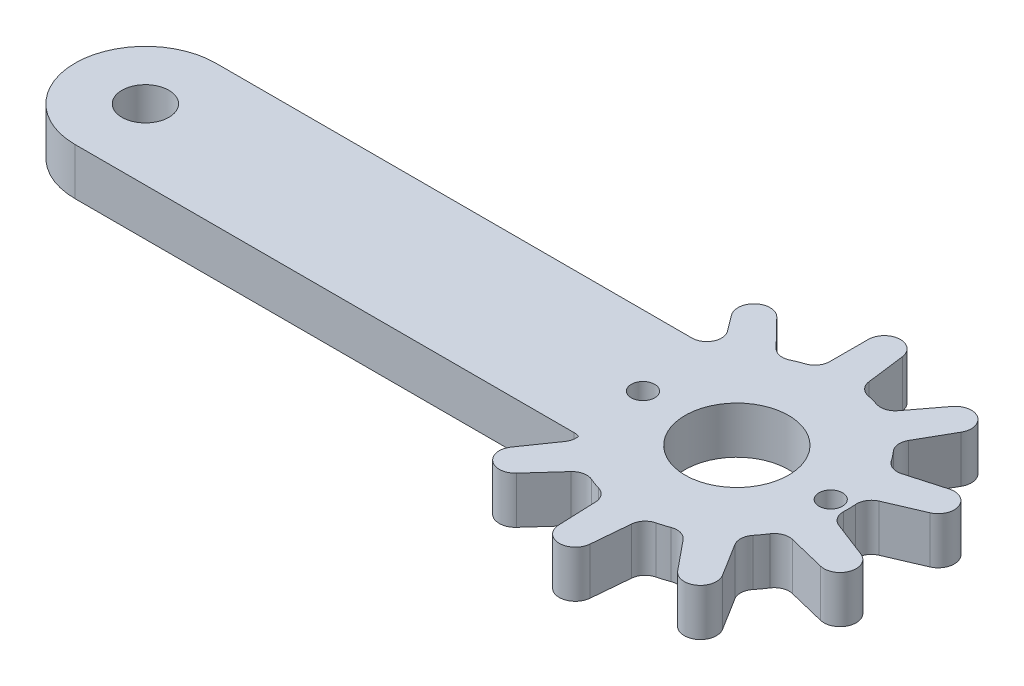
from build123d import *

# Parameters (mm, degrees)
CROQUIS1_R              = 1.5875
SALIENTE_EXTRUIR1_DEPTH = 3.175
SALIENTE_EXTRUIR2_START = -3.175
CROQUIS2_R              = 7.5
CROQUIS2_R_2            = 1.5875
SALIENTE_EXTRUIR2_DEPTH = 3.175
CROQUIS7_R              = 3.5
CROQUIS7_R_2            = 0.79375
CORTAR_EXTRUIR3_DEPTH   = 10
SALIENTE_EXTRUIR3_START = -3.175
SALIENTE_EXTRUIR3_DEPTH = 3.175
CORTAR_EXTRUIR4_START   = -10
CORTAR_EXTRUIR4_DEPTH   = 10
MATRIZC1_COUNT          = 8
MATRIZC1_ANGLE          = 259
REDONDEO1_R             = 1


with BuildPart() as part:
    # Croquis1 → Saliente-Extruir1 (new body)
    with BuildSketch(Plane(origin=(0, 0, 0), x_dir=(1, 0, 0), z_dir=(0, 1, 0))):
        with BuildLine():
            Line((-20, 0), (20, 0))
            ThreePointArc((20, 0), (24.7625, -4.7625), (20, -9.525))
            Line((20, -9.525), (-20, -9.525))
            ThreePointArc((-20, -9.525), (-24.7625, -4.7625), (-20, 0))
        make_face()
        with Locations(Location((-20, -4.7625, 0), (0, 0, 270))):
            Circle(CROQUIS1_R, mode=Mode.SUBTRACT)
        with Locations(Location((20, -4.7625, 0), (0, 0, 270))):
            Circle(CROQUIS1_R, mode=Mode.SUBTRACT)
    extrude(amount=SALIENTE_EXTRUIR1_DEPTH)

    # Croquis2 → Saliente-Extruir2 (add)
    with BuildSketch(Plane(origin=(0, 3.175, 0), x_dir=(1, 0, 0), z_dir=(0, 1, 0)).offset(SALIENTE_EXTRUIR2_START)):
        with Locations((20, -4.7625)):
            Circle(CROQUIS2_R)
        with Locations(Location((20, -4.7625, 0), (0, 0, 270))):
            Circle(CROQUIS2_R_2, mode=Mode.SUBTRACT)
    extrude(amount=SALIENTE_EXTRUIR2_DEPTH)

    # Croquis7 → Cortar-Extruir3 (cut)
    with BuildSketch(Plane(origin=(0, 3.175, 0), x_dir=(1, 0, 0), z_dir=(0, 1, 0))):
        with Locations(Location((20, -4.7625, 0), (0, 0, 270))):
            Circle(CROQUIS7_R)
        with Locations(Location((13.65, -4.7625, 0), (0, 0, 270))):
            Circle(CROQUIS7_R_2)
        with Locations(Location((26.35, -4.7625, 0), (0, 0, 270))):
            Circle(CROQUIS7_R_2)
    extrude(amount=-CORTAR_EXTRUIR3_DEPTH, mode=Mode.SUBTRACT)

    # Croquis8 → Saliente-Extruir3 (add)
    with BuildSketch(Plane(origin=(0, 3.175, 0), x_dir=(1, 0, 0), z_dir=(0, 1, 0)).offset(SALIENTE_EXTRUIR3_START)):
        with BuildLine():
            Line((11.607813982, 3.461471902), (14.206158981, 0))
            ThreePointArc((14.206158981, 0), (15.121179891, 0.933736858), (16.184441281, 1.694396442))
            Line((16.184441281, 1.694396442), (13.163387879, 4.793819098))
            ThreePointArc((13.163387879, 4.793819098), (12.356515163, 4.161604411), (11.607813982, 3.461471902))
        make_face()
    saliente_extruir3 = extrude(amount=SALIENTE_EXTRUIR3_DEPTH)

    # Croquis9 → Cortar-Extruir4 (cut)
    with BuildSketch(Plane(origin=(0, 3.175, 0), x_dir=(1, 0, 0), z_dir=(0, 1, 0)).offset(CORTAR_EXTRUIR4_START)):
        with BuildLine():
            ThreePointArc((12.35651523, 4.161604469), (11.974526132, 3.819706546), (11.607813982, 3.461471902))
            Line((11.607813982, 3.461471902), (12.19397403, 2.680599255))
            ThreePointArc((12.19397403, 2.680599255), (11.982381708, 3.453243741), (12.35651523, 4.161604469))
        make_face()
        with BuildLine():
            ThreePointArc((13.163387879, 4.793819098), (12.753054069, 4.486514795), (12.35651523, 4.161604469))
            ThreePointArc((12.35651523, 4.161604469), (13.113956627, 4.422436237), (13.844906618, 4.094621057))
            Line((13.844906618, 4.094621057), (13.163387879, 4.793819098))
        make_face()
    cortar_extruir4 = extrude(amount=CORTAR_EXTRUIR4_DEPTH, mode=Mode.SUBTRACT)

    # MatrizC1: Saliente-Extruir3, Cortar-Extruir4 ×8 about axis
    matrizc1_axis = Axis((20, 0, 4.7625), (0, -1, 0))
    add([saliente_extruir3.rotate(matrizc1_axis, i * MATRIZC1_ANGLE / (MATRIZC1_COUNT - 1)) for i in range(1, MATRIZC1_COUNT)])
    add([cortar_extruir4.rotate(matrizc1_axis, i * MATRIZC1_ANGLE / (MATRIZC1_COUNT - 1)) for i in range(1, MATRIZC1_COUNT)], mode=Mode.SUBTRACT)

    # Redondeo1
    # the kernel refuses this fillet: 1 mm, written as the material it adds along each edge
    with BuildSketch(Plane(origin=(25.155056708, 0, -0.685012307), x_dir=(0.6933697506528057, 0, 0.7205819792915072), z_dir=(0, 1, 0)), Plane(origin=(27.395406089, 0, 3.514313802), x_dir=(0.12009264391370789, 0, 0.9927626891044079), z_dir=(0, 1, 0)), Plane(origin=(26.657411119, 0, 8.216320666), x_dir=(-0.501549250802915, 0, 0.8651290938461349), z_dir=(0, 1, 0)), Plane(origin=(23.238283761, 0, 11.527373856), x_dir=(-0.9212027273713431, 0, 0.389082941136718), z_dir=(0, 1, 0)), Plane(origin=(18.515005687, 0, 12.114016299), x_dir=(-0.9698611692594302, 0, -0.243658187555294), z_dir=(0, 1, 0)), Plane(origin=(14.389777858, 0, 9.739990082), x_dir=(-0.6279284118017822, 0, -0.7782711029275668), z_dir=(0, 1, 0)), Plane(origin=(16.184441281, 0, -1.694396442), x_dir=(0.8837864601497757, 0, -0.4678904710035554), z_dir=(0, 1, 0)), Plane(origin=(20.838616598, 0, -2.690467342), x_dir=(0.9874067650142349, 0, 0.15820202402031353), z_dir=(0, 1, 0))) as redondeo1_piece_1:
        with BuildLine():
            CenterArc((0.748840141, 0.998904162), REDONDEO1_R, 196.368950511, 70.948483307)
            Line((-0.210626698, 0.717082614), (0, 0))
            ThreePointArc((0, 0), (0.351018816, 0.008218784), (0.702037632, 0))
        make_face()
    extrude(amount=3.175)
    with BuildSketch(Plane(origin=(22.981009808, 0, -2.119620351), x_dir=(0.6032966406304949, 0, -0.7975168734289948), z_dir=(0, 1, 0)), Plane(origin=(26.522503707, 0, 1.06021079), x_dir=(0.9617717559465732, 0, -0.2738523132336944), z_dir=(0, 1, 0)), Plane(origin=(27.437196341, 0, 5.731061088), x_dir=(0.9329135130884484, 0, 0.36010050971495355), z_dir=(0, 1, 0)), Plane(origin=(25.35671448, 0, 10.011843767), x_dir=(0.5283439627642348, 0, 0.8490304217226758), z_dir=(0, 1, 0)), Plane(origin=(21.11892846, 0, 12.178563585), x_dir=(-0.0890050127232042, 0, 0.9960311780813601), z_dir=(0, 1, 0)), Plane(origin=(16.430517523, 0, 11.358619681), x_dir=(-0.6705090902301596, 0, 0.7419013141373477), z_dir=(0, 1, 0)), Plane(origin=(18.238976871, 0, -2.527822183), x_dir=(0.0018564846529317855, 0, -0.9999982767308818), z_dir=(0, 1, 0))) as redondeo1_piece_2:
        with BuildLine():
            CenterArc((0.747376131, 1), REDONDEO1_R, 199.051516693, 70.948483307)
            ThreePointArc((-0.197849332, 0.673581828), (-0.091039016, 0.339107144), (0, 0))
            Line((0, 0), (0.747376131, 0))
        make_face()
    extrude(amount=3.175)
    with BuildSketch(Plane(origin=(14.206158981, 3.175, 0), x_dir=(-1, 0, 0), z_dir=(0, -1, 0))) as redondeo1_piece_3:
        with BuildLine():
            CenterArc((REDONDEO1_R * 2.00103600097, REDONDEO1_R), REDONDEO1_R, 143.106368796, 126.893631204)
            Line((REDONDEO1_R * 1.20128460683, REDONDEO1_R * 1.6003313315), (0, 0))
            Line((0, 0), (REDONDEO1_R * 2.00103600097, 0))
        make_face()
    extrude(amount=3.175)
    with BuildSketch(Plane(origin=(14.206158981, 3.175, 9.525), x_dir=(-1, 0, 0), z_dir=(0, -1, 0))) as redondeo1_piece_4:
        with BuildLine():
            CenterArc((0.454646298, -1), REDONDEO1_R, 90, 47.317031956)
            ThreePointArc((-0.280469857, -0.322058824), (-0.137942125, -0.163026135), (0, 0))
            Line((0, 0), (0.454646298, 0))
        make_face()
    extrude(amount=3.175)


solid = part.part
